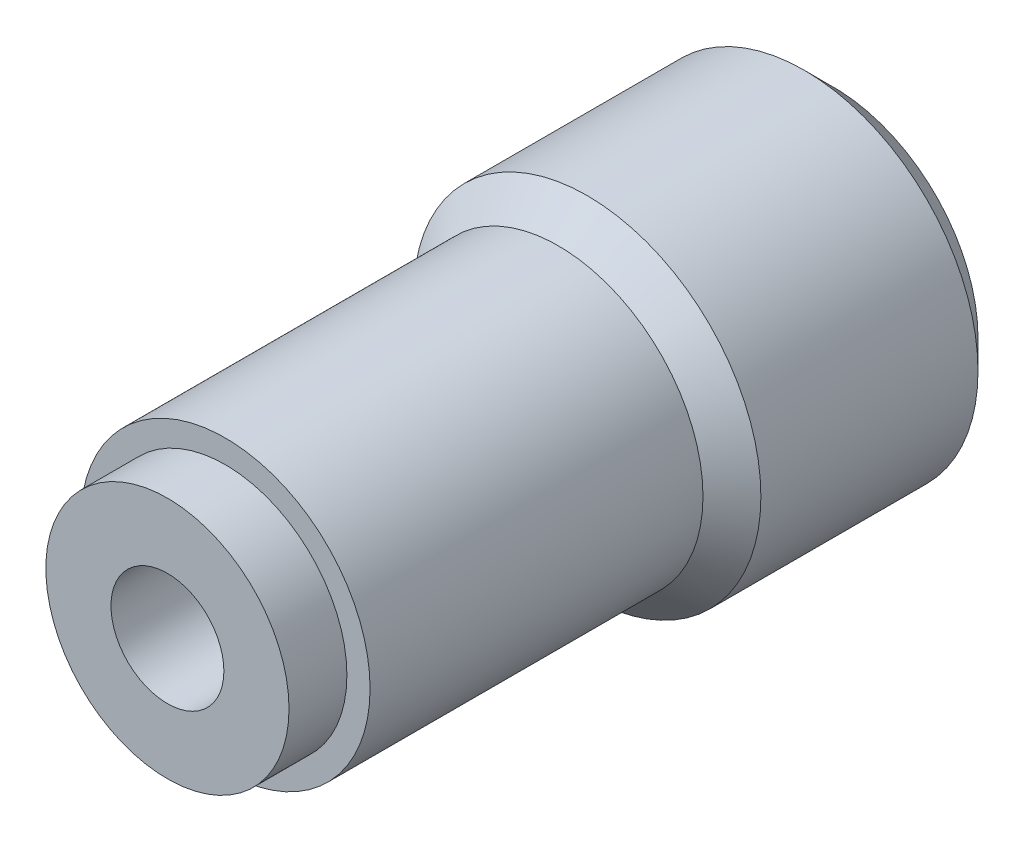
from build123d import *

# Parameters (mm, degrees)
SKETCH_1_R          = 5
SKETCH_1_R_2        = 1.95
EXTRUDE_1_DEPTH     = 15
SKETCH_3_R          = 3.5
CUT_EXTRUDE_1_DEPTH = 4
EXTRUDE_START       = -8
SKETCH_4_R          = 6
SKETCH_4_R_2        = 3.5
EXTRUDE_2_DEPTH     = 8
CHAMFER_1_SIZE      = 1.5
CHAMFER_2_SIZE      = 1
CUT_EXTRUDE_START   = -2
SKETCH_9_R          = 5
SKETCH_9_R_2        = 4.2
CUT_EXTRUDE_4_DEPTH = 2


with BuildPart() as part:
    # 스케치1 → 보스-돌출1 (new body)
    with BuildSketch(Plane.XY):
        Circle(SKETCH_1_R)
        Circle(SKETCH_1_R_2, mode=Mode.SUBTRACT)
    extrude(amount=EXTRUDE_1_DEPTH)

    # 스케치3 → 컷-돌출1 (cut)
    with BuildSketch(Plane.XY):
        Circle(SKETCH_3_R)
    extrude(amount=CUT_EXTRUDE_1_DEPTH, mode=Mode.SUBTRACT)

    # 스케치4 → 보스-돌출2 (add)
    with BuildSketch(Plane.XY.offset(EXTRUDE_START)):
        Circle(SKETCH_4_R)
        Circle(SKETCH_4_R_2, mode=Mode.SUBTRACT)
    extrude(amount=EXTRUDE_2_DEPTH)

    # 모따기1
    # the kernel refuses this chamfer: 1.5 mm, written as the material it adds along each edge
    with BuildSketch(Plane(origin=(0, 0, 0), x_dir=(1, 0, 0), z_dir=(0, -1, 0))) as chamfer_1_piece_1_section:
        Polygon((5, CHAMFER_1_SIZE), (5 + CHAMFER_1_SIZE, 0), (5, 0), align=None)
    chamfer_1_piece_1 = revolve(axis=Axis((0, 0, 0), (0, 0, 1)), mode=Mode.PRIVATE)
    chamfer_1_piece_1 = chamfer_1_piece_1 & Plane(origin=(0, 0, 0.997696527), x_dir=(1, 0, 0), z_dir=(0, 0, -1)) * Cylinder(6, 26, mode=Mode.PRIVATE)
    add(chamfer_1_piece_1)

    # 모따기2
    chamfer_2_edges = [part.edges().sort_by_distance(p)[0] for p in [
        (-6, 0, -8),
    ]]
    chamfer(chamfer_2_edges, length=CHAMFER_2_SIZE)

    # 스케치9 → 컷-돌출4 (cut)
    with BuildSketch(Plane.XY.offset(15).offset(CUT_EXTRUDE_START)):
        Circle(SKETCH_9_R)
        Circle(SKETCH_9_R_2, mode=Mode.SUBTRACT)
    extrude(amount=CUT_EXTRUDE_4_DEPTH, mode=Mode.SUBTRACT)


solid = part.part
